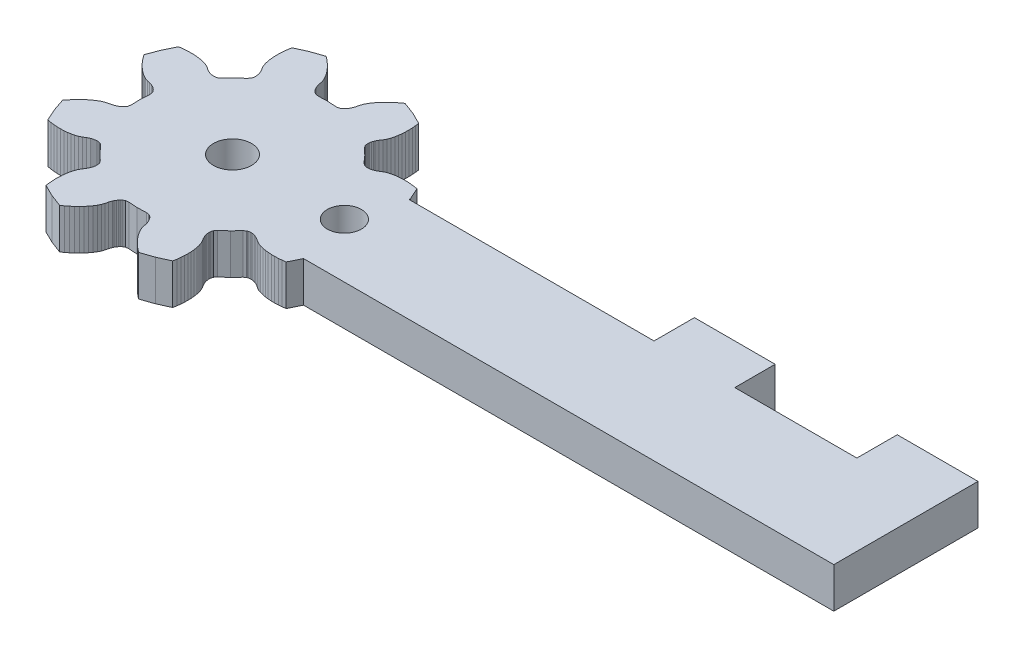
from build123d import *

# Parameters (mm, degrees)
SKETCH1_R           = 1.5
SKETCH1_R_2         = 1.3413
BOSS_EXTRUDE1_DEPTH = 3.175


with BuildPart() as part:
    # Sketch1 → Boss-Extrude1 (new body)
    with BuildSketch(Plane(origin=(0, 0, 0), x_dir=(1, 0, 0), z_dir=(0, 1, 0))):
        Polygon((118.534060584, 166.096137226), (137.790699812, 166.096137226), (137.790699812, 169.271137226), (144.140699812, 169.271137226), (144.140699812, 166.096137226), (153.740699812, 166.096137226), (153.740699812, 169.271137226), (160.090699812, 169.271137226), (160.090699812, 166.096137226), (160.090699812, 157.932387226), (118.404460584, 157.925837226), (118.404460584, 157.938937226), (117.948960584, 157.011237226), (117.666260584, 156.973637226), (117.388060584, 156.949237226), (117.115260584, 156.938437226), (116.848260584, 156.941137226), (116.587860584, 156.957637226), (116.334960584, 156.988337226), (116.090460584, 157.033737226), (115.855760584, 157.095237226), (115.633260584, 157.175137226), (115.430660584, 157.283537226), (115.242560584, 157.412637226), (115.039160584, 157.520037226), (114.930060584, 157.563737226), (114.814560584, 157.598937226), (114.690760584, 157.623237226), (114.624660584, 157.630037226), (114.554760584, 157.631937226), (114.479660584, 157.627537226), (114.396560584, 157.613337226), (114.298660584, 157.581537226), (114.114360584, 157.447837226), (113.631560584, 156.933037226), (113.101860584, 156.466737226), (112.962460584, 156.286637226), (112.927560584, 156.189837226), (112.910860584, 156.107237226), (112.904060584, 156.032237226), (112.903760584, 155.962337226), (112.908460584, 155.896037226), (112.928860584, 155.771537226), (112.960360584, 155.655037226), (113.000660584, 155.544637226), (113.101660584, 155.337837226), (113.224760584, 155.145937226), (113.326760584, 154.939937226), (113.399560584, 154.715037226), (113.453660584, 154.478537226), (113.491460584, 154.232737226), (113.514160584, 153.978937226), (113.522460584, 153.718237226), (113.516760584, 153.451337226), (113.497360584, 153.178937226), (113.464360584, 152.901637226), (113.417760584, 152.620237226), (112.476260584, 152.194137226), (111.498260584, 151.860237226), (111.271660584, 152.033537226), (111.057760584, 152.213037226), (110.857160584, 152.398237226), (110.670260584, 152.588937226), (110.497860584, 152.784737226), (110.340660584, 152.985237226), (110.199960584, 153.190337226), (110.077460584, 153.399737226), (109.976660584, 153.613537226), (109.909960584, 153.833537226), (109.868360584, 154.057737226), (109.800360584, 154.277537226), (109.754160584, 154.385637226), (109.697360584, 154.492137226), (109.627060584, 154.596837226), (109.585060584, 154.648337226), (109.537060584, 154.699137226), (109.480760584, 154.749137226), (109.412060584, 154.797937226), (109.320260584, 154.844637226), (109.095460584, 154.880437226), (108.390060584, 154.857737226), (107.685660584, 154.902637226), (107.459860584, 154.873837226), (107.366660584, 154.830037226), (107.296460584, 154.783437226), (107.238560584, 154.735237226), (107.188960584, 154.685937226), (107.145460584, 154.635837226), (107.071860584, 154.533337226), (107.011760584, 154.428637226), (106.962160584, 154.322137226), (106.887360584, 154.104537226), (106.838660584, 153.881737226), (106.765160584, 153.663937226), (106.657560584, 153.453437226), (106.528660584, 153.248037226), (106.381560584, 153.047437226), (106.218160584, 152.851937226), (106.039660584, 152.661737226), (105.846860584, 152.476937226), (105.640560584, 152.298037226), (105.421160584, 152.125437226), (105.189160584, 151.959337226), (104.222160584, 152.323837226), (103.294460584, 152.779237226), (103.256760584, 153.062037226), (103.232460584, 153.340137226), (103.221660584, 153.613037226), (103.224360584, 153.879937226), (103.240860584, 154.140337226), (103.271460584, 154.393337226), (103.316960584, 154.637837226), (103.378460584, 154.872437226), (103.458360584, 155.094937226), (103.566760584, 155.297637226), (103.695860584, 155.485637226), (103.803260584, 155.689137226), (103.846960584, 155.798237226), (103.882160584, 155.913637226), (103.906460584, 156.037437226), (103.913160584, 156.103537226), (103.915160584, 156.173437226), (103.910660584, 156.248637226), (103.896560584, 156.331737226), (103.864760584, 156.429637226), (103.731060584, 156.613937226), (103.216260584, 157.096637226), (102.749860584, 157.626437226), (102.569860584, 157.765737226), (102.473060584, 157.800737226), (102.390460584, 157.817437226), (102.315460584, 157.824237226), (102.245460584, 157.824437226), (102.179260584, 157.819737226), (102.054760584, 157.799437226), (101.938260584, 157.767837226), (101.827860584, 157.727637226), (101.621060584, 157.626637226), (101.429160584, 157.503537226), (101.223160584, 157.401537226), (100.998260584, 157.328637226), (100.761760584, 157.274537226), (100.515960584, 157.236837226), (100.262160584, 157.214137226), (100.001460584, 157.205837226), (99.734460584, 157.211437226), (99.462060584, 157.230837226), (99.184860584, 157.263937226), (98.903360584, 157.310437226), (98.477360584, 158.252037226), (98.143460584, 159.230037226), (98.316660584, 159.456637226), (98.496160584, 159.670437226), (98.681460584, 159.871137226), (98.872160584, 160.057937226), (99.067960584, 160.230437226), (99.268460584, 160.387637226), (99.473560584, 160.528337226), (99.682860584, 160.650737226), (99.896760584, 160.751637226), (100.116660584, 160.818337226), (100.340960584, 160.859937226), (100.560760584, 160.927837226), (100.668860584, 160.974137226), (100.775260584, 161.030837226), (100.879960584, 161.101237226), (100.931560584, 161.143137226), (100.982360584, 161.191237226), (101.032360584, 161.247537226), (101.081160584, 161.316237226), (101.127860584, 161.408037226), (101.163660584, 161.632837226), (101.140860584, 162.338237226), (101.185760584, 163.042537226), (101.157060584, 163.268337226), (101.113260584, 163.361537226), (101.066660584, 163.431837226), (101.018460584, 163.489637226), (100.969160584, 163.539237226), (100.918960584, 163.582837226), (100.816560584, 163.656437226), (100.711860584, 163.716537226), (100.605360584, 163.766137226), (100.387760584, 163.840937226), (100.164960584, 163.889537226), (99.947160584, 163.963137226), (99.736660584, 164.070637226), (99.531160584, 164.199637226), (99.330660584, 164.346737226), (99.135160584, 164.510137226), (98.944860584, 164.688637226), (98.760160584, 164.881337226), (98.581260584, 165.087737226), (98.408660584, 165.307137226), (98.242560584, 165.539037226), (98.607060584, 166.506037226), (99.062460584, 167.433737226), (99.345260584, 167.471437226), (99.623360584, 167.495737226), (99.896260584, 167.506637226), (100.163160584, 167.503937226), (100.423560584, 167.487437226), (100.676460584, 167.456737226), (100.920960584, 167.411237226), (101.155660584, 167.349837226), (101.378160584, 167.269937226), (101.580860584, 167.161537226), (101.768860584, 167.032437226), (101.972360584, 166.924937226), (102.081460584, 166.881337226), (102.196860584, 166.846137226), (102.320660584, 166.821837226), (102.386760584, 166.815037226), (102.456660584, 166.813137226), (102.531760584, 166.817537226), (102.614860584, 166.831637226), (102.712860584, 166.863537226), (102.897160584, 166.997137226), (103.379860584, 167.512037226), (103.909560584, 167.978337226), (104.048960584, 168.158337226), (104.083860584, 168.255237226), (104.100560584, 168.337837226), (104.107460584, 168.412737226), (104.107660584, 168.482737226), (104.102960584, 168.549037226), (104.082560584, 168.673537226), (104.051060584, 168.789937226), (104.010760584, 168.900337226), (103.909860584, 169.107137226), (103.786660584, 169.299137226), (103.684660584, 169.505137226), (103.611860584, 169.730037226), (103.557760584, 169.966537226), (103.519960584, 170.212237226), (103.497360584, 170.466137226), (103.488960584, 170.726837226), (103.494660584, 170.993737226), (103.514060584, 171.266137226), (103.547160584, 171.543337226), (103.593660584, 171.824837226), (104.535260584, 172.250837226), (105.513260584, 172.584837226), (105.739860584, 172.411537226), (105.953660584, 172.232037226), (106.154260584, 172.046737226), (106.341160584, 171.856037226), (106.513560584, 171.660337226), (106.670760584, 171.459737226), (106.811560584, 171.254737226), (106.933960584, 171.045337226), (107.034860584, 170.831537226), (107.101460584, 170.611537226), (107.143160584, 170.387337226), (107.211060584, 170.167437226), (107.257360584, 170.059437226), (107.314060584, 169.952937226), (107.384360584, 169.848237226), (107.426360584, 169.796737226), (107.474460584, 169.745937226), (107.530660584, 169.695937226), (107.599460584, 169.647137226), (107.691160584, 169.600437226), (107.916060584, 169.564637226), (108.621460584, 169.587337226), (109.325760584, 169.542437226), (109.551560584, 169.571237226), (109.644760584, 169.615037226), (109.714960584, 169.661537226), (109.772860584, 169.709737226), (109.822460584, 169.759037226), (109.866060584, 169.809237226), (109.939660584, 169.911637226), (109.999660584, 170.016337226), (110.049260584, 170.122837226), (110.124060584, 170.340537226), (110.172760584, 170.563337226), (110.246360584, 170.781037226), (110.353860584, 170.991637226), (110.482860584, 171.197037226), (110.629960584, 171.397537226), (110.793360584, 171.593037226), (110.971760584, 171.783337226), (111.164560584, 171.968137226), (111.370960584, 172.146937226), (111.590260584, 172.319637226), (111.822260584, 172.485737226), (112.789260584, 172.121237226), (113.716960584, 171.665837226), (113.754660584, 171.383037226), (113.778960584, 171.104937226), (113.789860584, 170.832037226), (113.787060584, 170.565037226), (113.770560584, 170.304737226), (113.739960584, 170.051737226), (113.694460584, 169.807237226), (113.632960584, 169.572637226), (113.553160584, 169.350037226), (113.444660584, 169.147437226), (113.315660584, 168.959437226), (113.208160584, 168.755937226), (113.164460584, 168.646837226), (113.129260584, 168.531337226), (113.105060584, 168.407637226), (113.098260584, 168.341537226), (113.096260584, 168.271637226), (113.100760584, 168.196437226), (113.114860584, 168.113337226), (113.146760584, 168.015437226), (113.280360584, 167.831137226), (113.795260584, 167.348437226), (114.261560584, 166.818637226), (114.441560584, 166.679237226), (114.538460584, 166.644337226), (114.621060584, 166.627637226), (114.695960584, 166.620837226), (114.765960584, 166.620637226), (114.832260584, 166.625337226), (114.956660584, 166.645637226), (115.073160584, 166.677237226), (115.183560584, 166.717437226), (115.390360584, 166.818437226), (115.582360584, 166.941537226), (115.788260584, 167.043537226), (116.013260584, 167.116437226), (116.249660584, 167.170437226), (116.495560584, 167.208237226), (116.749260584, 167.230937226), (117.010060584, 167.239237226), (117.276960584, 167.233637226), (117.549360584, 167.214137226), (117.826560584, 167.181137226), (118.108060584, 167.134537226), (118.534060584, 166.193037226), align=None)
        with Locations((108.516060584, 162.222537226)):
            Circle(SKETCH1_R, mode=Mode.SUBTRACT)
        with Locations((117.331860584, 162.206037226)):
            Circle(SKETCH1_R_2, mode=Mode.SUBTRACT)
    extrude(amount=BOSS_EXTRUDE1_DEPTH)


solid = part.part
